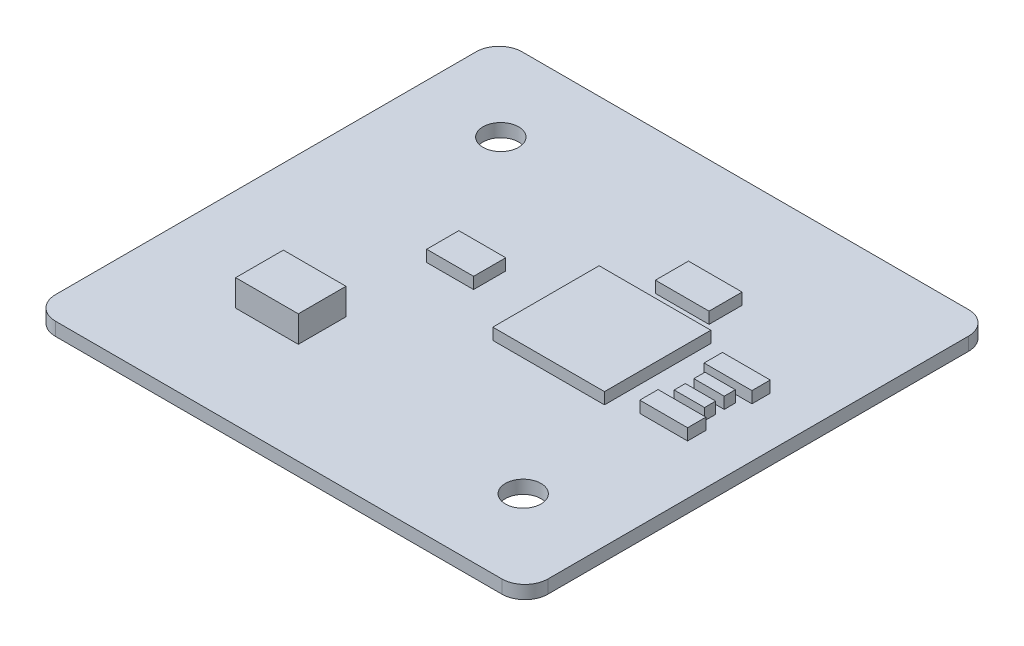
from build123d import *

# Parameters (mm, degrees)
BOSS_EXTRUDE1_DEPTH = 1.15
CUT_EXTRUDE1_REACH  = 31.537
SKETCH2_R           = 1.55
SKETCH3_W           = 5.45
SKETCH3_H           = 4.15
BOSS_EXTRUDE2_DEPTH = 2.3
SKETCH4_W           = 9.718661505
SKETCH4_H           = 9.252165754
SKETCH4_W_2         = 4.664957522
SKETCH4_H_2         = 2.876723805
SKETCH4_W_3         = 4.081837833
SKETCH4_H_3         = 2.798974514
SKETCH4_W_4         = 4.159587124
SKETCH4_H_4         = 1.593860487
SKETCH4_W_5         = 2.64347593
SKETCH4_H_5         = 0.971866151
BOSS_EXTRUDE3_DEPTH = 1


with BuildPart() as part:
    # Sketch1 → Boss-Extrude1 (new body)
    with BuildSketch(Plane(origin=(0, 0, 0), x_dir=(1, 0, 0), z_dir=(0, 1, 0))):
        with BuildLine():
            Line((-19.425, 20.3), (19.425, 20.3))
            ThreePointArc((19.425, 20.3), (20.839213562, 19.714213562), (21.425, 18.3))
            Line((21.425, 18.3), (21.425, -18.3))
            ThreePointArc((21.425, -18.3), (20.839213562, -19.714213562), (19.425, -20.3))
            Line((19.425, -20.3), (-19.425, -20.3))
            ThreePointArc((-19.425, -20.3), (-20.839213562, -19.714213562), (-21.425, -18.3))
            Line((-21.425, -18.3), (-21.425, 18.3))
            ThreePointArc((-21.425, 18.3), (-20.839213562, 19.714213562), (-19.425, 20.3))
        make_face()
    extrude(amount=BOSS_EXTRUDE1_DEPTH)

    # Sketch2 → Cut-Extrude1 (cut, up to next)
    with BuildSketch(Plane(origin=(0, 1.15, 0), x_dir=(1, 0, 0), z_dir=(0, 1, 0)), mode=Mode.PRIVATE) as cut_extrude1_sk1:
        with Locations((-13.925, 12.95)):
            Circle(SKETCH2_R)
    cut_extrude1_tool1 = extrude(cut_extrude1_sk1.sketch, amount=-CUT_EXTRUDE1_REACH, mode=Mode.PRIVATE) & part.part
    # Sketch2 → Cut-Extrude1 (cut, up to next)
    with BuildSketch(Plane(origin=(0, 1.15, 0), x_dir=(1, 0, 0), z_dir=(0, 1, 0)), mode=Mode.PRIVATE) as cut_extrude1_sk2:
        with Locations((13.925, -12.95)):
            Circle(SKETCH2_R)
    cut_extrude1_tool2 = extrude(cut_extrude1_sk2.sketch, amount=-CUT_EXTRUDE1_REACH, mode=Mode.PRIVATE) & part.part
    add(cut_extrude1_tool1.solids().sort_by_distance((-13.925, 1.15, -12.95))[0], mode=Mode.SUBTRACT)
    add(cut_extrude1_tool2.solids().sort_by_distance((13.925, 1.15, 12.95))[0], mode=Mode.SUBTRACT)

    # Sketch3 → Boss-Extrude2 (add)
    with BuildSketch(Plane(origin=(0, 1.15, 0), x_dir=(1, 0, 0), z_dir=(0, 1, 0))):
        with Locations((-9.84, -9.405)):
            Rectangle(SKETCH3_W, SKETCH3_H)
    extrude(amount=BOSS_EXTRUDE2_DEPTH)

    # Sketch4 → Boss-Extrude3 (add)
    with BuildSketch(Plane(origin=(0, 1.15, 0), x_dir=(1, 0, 0), z_dir=(0, 1, 0))):
        with Locations((5.908946196, 1.904857655)):
            Rectangle(SKETCH4_W, SKETCH4_H)
        with Locations((6.919686992, 9.329915045)):
            Rectangle(SKETCH4_W_2, SKETCH4_H_2)
        with Locations((-5.656260997, 1.671609779)):
            Rectangle(SKETCH4_W_3, SKETCH4_H_3)
        with Locations((15.025050688, 4.567770907)):
            Rectangle(SKETCH4_W_4, SKETCH4_H_4)
        with Locations((14.99993444, 2.629590434)):
            Rectangle(SKETCH4_W_5, SKETCH4_H_5)
        with Locations((14.99993444, 0.91910601)):
            Rectangle(SKETCH4_W_5, SKETCH4_H_5)
        with Locations((15.025050688, -1.030178119)):
            Rectangle(SKETCH4_W_4, SKETCH4_H_4)
    extrude(amount=BOSS_EXTRUDE3_DEPTH)


solid = part.part
